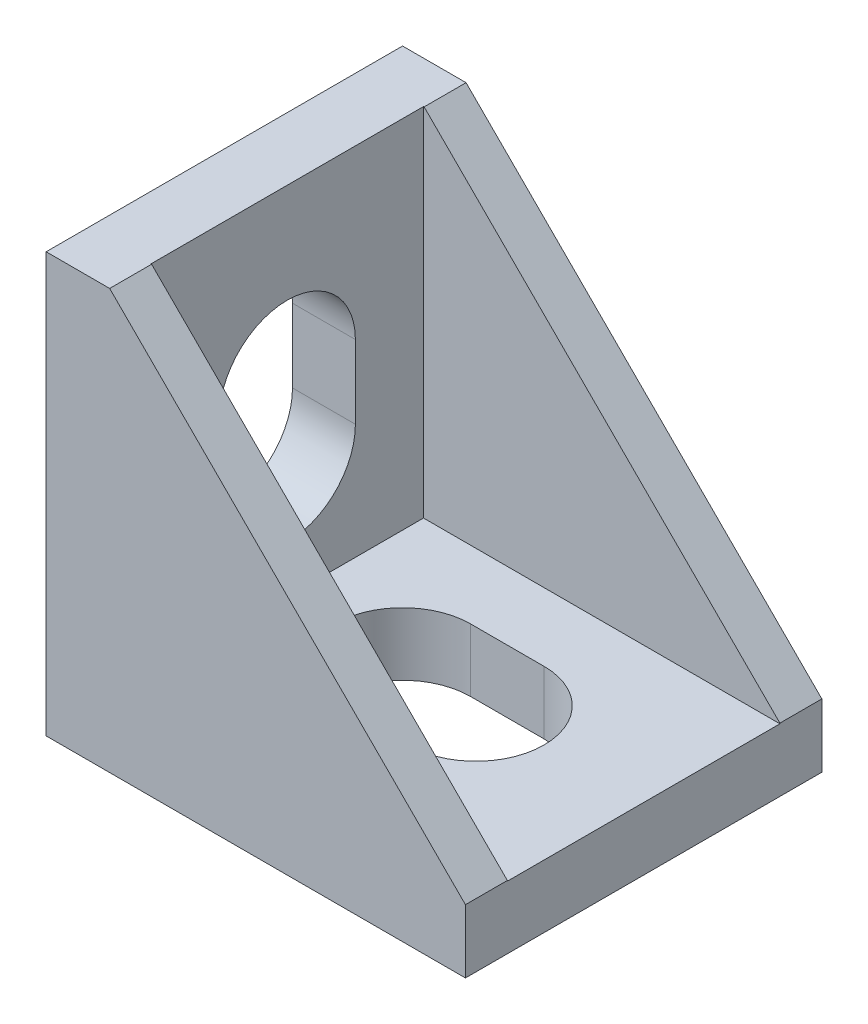
from build123d import *

# Parameters (mm, degrees)
BOSS_EXTRUDE1_DEPTH = 17
SKETCH2_W           = 17
SKETCH2_H           = 17
CUT_EXTRUDE1_DEPTH  = 13
CUT_EXTRUDE2_DEPTH  = 13
SKETCH6_W           = 3.5
SKETCH6_H           = 1.5
BOSS_EXTRUDE2_DEPTH = 1
FILLET1_R           = 0.75
SKETCH7_W           = 1.5
SKETCH7_H           = 3.5
BOSS_EXTRUDE3_DEPTH = 1
FILLET2_R           = 0.75
CUT_EXTRUDE3_DEPTH  = 10


with BuildPart() as part:
    # Sketch1 → Boss-Extrude1 (new body)
    with BuildSketch(Plane.XY):
        Polygon((0, 0), (0, 20), (3.029437252, 20), (20, 3.029437252), (20, 0), align=None)
    extrude(amount=BOSS_EXTRUDE1_DEPTH)

    # Sketch2 → Cut-Extrude1 (cut)
    with BuildSketch(Plane.XY.offset(2)):
        with Locations((11.5, 11.5)):
            Rectangle(SKETCH2_W, SKETCH2_H)
    extrude(amount=CUT_EXTRUDE1_DEPTH, mode=Mode.SUBTRACT)

    # Sketch3 → Cut-Extrude2 (cut)
    with BuildSketch(Plane(origin=(0, 0, 0), x_dir=(1, 0, 0), z_dir=(0, 1, 0))):
        with BuildLine():
            Line((8.5, -5.25), (12, -5.25))
            ThreePointArc((12, -5.25), (15.25, -8.5), (12, -11.75))
            Line((12, -11.75), (8.5, -11.75))
            ThreePointArc((8.5, -11.75), (5.25, -8.5), (8.5, -5.25))
        make_face()
    extrude(amount=CUT_EXTRUDE2_DEPTH, mode=Mode.SUBTRACT)

    # Sketch6 → Boss-Extrude2 (add)
    with BuildSketch(Plane(origin=(0, 0, 0), x_dir=(0, 0, -1), z_dir=(1, 0, 0))):
        with Locations((-8.25, 18.25)):
            Rectangle(SKETCH6_W, SKETCH6_H)
        with Locations((-8.25, 2.75)):
            Rectangle(SKETCH6_W, SKETCH6_H)
    extrude(amount=-BOSS_EXTRUDE2_DEPTH)

    # Fillet1
    fillet1_edges = [part.edges().sort_by_distance(p)[0] for p in [
        (-0.5, 2, 6.5),
        (-0.5, 17.5, 6.5),
        (-0.5, 2, 10),
        (-0.5, 3.5, 10),
        (-0.5, 3.5, 6.5),
        (-0.5, 17.5, 10),
        (-0.5, 19, 10),
        (-0.5, 19, 6.5),
    ]]
    fillet(fillet1_edges, radius=FILLET1_R - 0.0001)  # a hair under: the kernel refuses the full size

    # Sketch7 → Boss-Extrude3 (add)
    with BuildSketch(Plane(origin=(0, 0, 0), x_dir=(1, 0, 0), z_dir=(0, 1, 0))):
        with Locations((2.75, -8.25)):
            Rectangle(SKETCH7_W, SKETCH7_H)
        with Locations((18.25, -8.25)):
            Rectangle(SKETCH7_W, SKETCH7_H)
    extrude(amount=-BOSS_EXTRUDE3_DEPTH)

    # Fillet2
    fillet2_edges = [part.edges().sort_by_distance(p)[0] for p in [
        (3.5, -0.5, 6.5),
        (2, -0.5, 6.5),
        (2, -0.5, 10),
        (3.5, -0.5, 10),
        (17.5, -0.5, 10),
        (19, -0.5, 10),
        (17.5, -0.5, 6.5),
        (19, -0.5, 6.5),
    ]]
    fillet(fillet2_edges, radius=FILLET2_R - 0.0001)  # a hair under: the kernel refuses the full size

    # Sketch8 → Cut-Extrude3 (cut)
    with BuildSketch(Plane(origin=(0, 0, 0), x_dir=(0, 0, -1), z_dir=(1, 0, 0))):
        with BuildLine():
            Line((-11.75, 8.5), (-11.75, 12))
            ThreePointArc((-11.75, 12), (-8.5, 15.25), (-5.25, 12))
            Line((-5.25, 12), (-5.25, 8.5))
            ThreePointArc((-5.25, 8.5), (-8.5, 5.25), (-11.75, 8.5))
        make_face()
    extrude(amount=CUT_EXTRUDE3_DEPTH, mode=Mode.SUBTRACT)


solid = part.part
